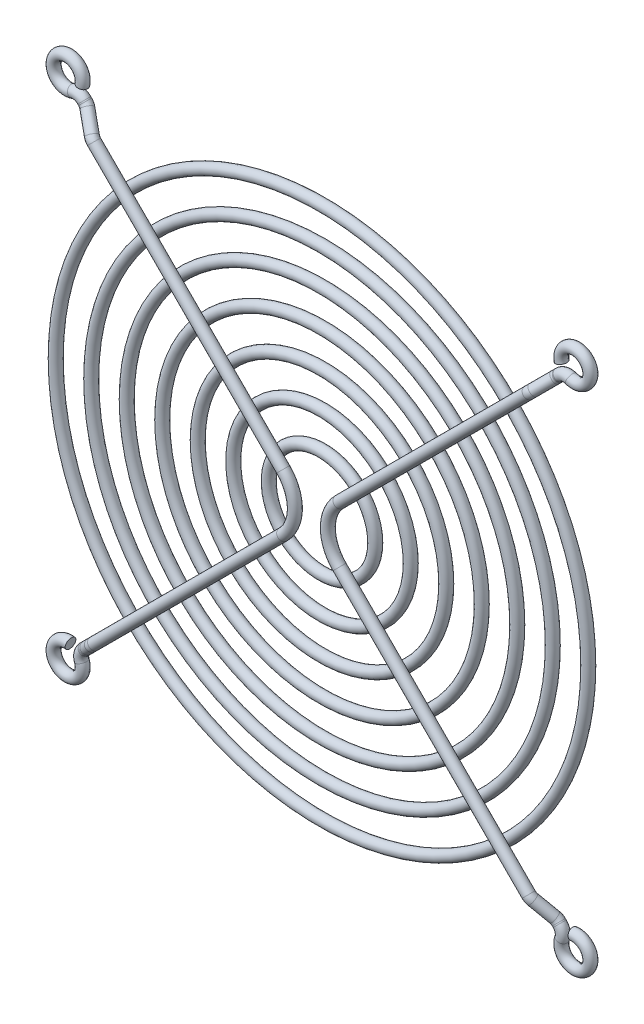
from build123d import *

# Parameters (mm, degrees)
SWEEP2_PROFILE_R     = 0.75
SWEEP3_PROFILE_R     = 0.75
SWEEP4_PROFILE_R     = 0.75
SWEEP5_PROFILE_R     = 0.75
SWEEP6_PROFILE_R     = 0.75
SWEEP7_PROFILE_R     = 0.75
SWEEP8_PROFILE_R     = 0.75
SWEEP10_OUTLINE_R    = 0.75
SWEEP10_ANGLE        = 299.351903
SWEEP10_2_OUTLINE_R  = 0.75
SWEEP10_2_ANGLE      = 65.00525
SWEEP10_3_OUTLINE_R  = 0.75
SWEEP10_3_ANGLE      = 24.91303
SWEEP10_4_OUTLINE_R  = 0.75
SWEEP10_4_ANGLE      = 24.91303
SWEEP10_5_OUTLINE_R  = 0.75
SWEEP10_5_ANGLE      = 90
SWEEP10_6_OUTLINE_R  = 0.75
SWEEP10_6_ANGLE      = 24.91303
SWEEP10_7_OUTLINE_R  = 0.75
SWEEP10_7_ANGLE      = 24.91303
SWEEP10_8_OUTLINE_R  = 0.75
SWEEP10_8_ANGLE      = 65.00525
SWEEP10_9_OUTLINE_R  = 0.75
SWEEP10_9_ANGLE      = 303.434631
SWEEP10_START        = -47.340604846
SWEEP10_10_OUTLINE_R = 0.75
SWEEP10_10_DEPTH     = 0.168652393
SWEEP10_START_2      = -42.150656374
SWEEP10_11_OUTLINE_R = 0.75
SWEEP10_11_DEPTH     = 2.898202414
SWEEP10_START_3      = -43.279707019
SWEEP10_12_OUTLINE_R = 0.75
SWEEP10_12_DEPTH     = 37.668652394
SWEEP10_13_OUTLINE_R = 0.75
SWEEP10_13_DEPTH     = 37.668652394
SWEEP10_14_OUTLINE_R = 0.75
SWEEP10_14_DEPTH     = 2.898202414
SWEEP10_15_OUTLINE_R = 0.75
SWEEP10_15_DEPTH     = 0.168652393


with BuildPart() as part:
    # Sweep2: sweep along a path in Sketch1
    with BuildLine(Plane.XY) as sweep2_path:
        CenterArc((0, 0), 7.5, 0, 360)
    # Sweep2 profile (on start of the path) → Sweep2 (sweep)
    with BuildSketch(Plane(origin=(7.5, 0, 0), x_dir=(0, 0, 1), z_dir=(0, 1, 0))):
        Circle(SWEEP2_PROFILE_R)
    sweep(path=sweep2_path.line)


with BuildPart() as body_2:
    # Sweep3: sweep along a path in Sketch38
    with BuildLine(Plane.XY) as sweep3_path:
        CenterArc((0, 0), 12.5, 0, 360)
    # Sweep3 profile (on start of the path) → Sweep3 (sweep)
    with BuildSketch(Plane(origin=(12.5, 0, 0), x_dir=(0, 0, 1), z_dir=(0, 1, 0))):
        Circle(SWEEP3_PROFILE_R)
    sweep(path=sweep3_path.line)


with BuildPart() as body_3:
    # Sweep4: sweep along a path in Sketch51
    with BuildLine(Plane.XY) as sweep4_path:
        CenterArc((0, 0), 17.5, 0, 360)
    # Sweep4 profile (on start of the path) → Sweep4 (sweep)
    with BuildSketch(Plane(origin=(17.5, 0, 0), x_dir=(0, 0, 1), z_dir=(0, 1, 0))):
        Circle(SWEEP4_PROFILE_R)
    sweep(path=sweep4_path.line)


with BuildPart() as body_4:
    # Sweep5: sweep along a path in Sketch76
    with BuildLine(Plane.XY) as sweep5_path:
        CenterArc((0, 0), 22.5, 0, 360)
    # Sweep5 profile (on start of the path) → Sweep5 (sweep)
    with BuildSketch(Plane(origin=(22.5, 0, 0), x_dir=(0, 0, 1), z_dir=(0, 1, 0))):
        Circle(SWEEP5_PROFILE_R)
    sweep(path=sweep5_path.line)


with BuildPart() as body_5:
    # Sweep6: sweep along a path in Sketch89
    with BuildLine(Plane.XY) as sweep6_path:
        CenterArc((0, 0), 27.5, 0, 360)
    # Sweep6 profile (on start of the path) → Sweep6 (sweep)
    with BuildSketch(Plane(origin=(27.5, 0, 0), x_dir=(0, 0, 1), z_dir=(0, 1, 0))):
        Circle(SWEEP6_PROFILE_R)
    sweep(path=sweep6_path.line)


with BuildPart() as body_6:
    # Sweep7: sweep along a path in Sketch99
    with BuildLine(Plane.XY) as sweep7_path:
        CenterArc((0, 0), 32.5, 0, 360)
    # Sweep7 profile (on start of the path) → Sweep7 (sweep)
    with BuildSketch(Plane(origin=(32.5, 0, 0), x_dir=(0, 0, 1), z_dir=(0, 1, 0))):
        Circle(SWEEP7_PROFILE_R)
    sweep(path=sweep7_path.line)


with BuildPart() as body_7:
    # Sweep8: sweep along a path in Sketch108
    with BuildLine(Plane.XY) as sweep8_path:
        CenterArc((0, 0), 37.5, 0, 360)
    # Sweep8 profile (on start of the path) → Sweep8 (sweep)
    with BuildSketch(Plane(origin=(37.5, 0, 0), x_dir=(0, 0, 1), z_dir=(0, 1, 0))):
        Circle(SWEEP8_PROFILE_R)
    sweep(path=sweep8_path.line)


with BuildPart() as body_8:
    # Sweep10: read off the stored shape, not the designer's step
    # Sweep10 outline → Sweep10 (revolve)
    with BuildSketch(Plane(origin=(-35.75, -35.75, 0), x_dir=(0.1624073083987901, 0.9867238044045863, 0), z_dir=(0.9867238044045863, -0.1624073083987901, 0))):
        with Locations((2.05, 0)):
            Circle(SWEEP10_OUTLINE_R)
    revolve(axis=Axis((-35.75, -35.75, 0), (0, 0, 1)), revolution_arc=SWEEP10_ANGLE)

    # Sweep10 2 outline → Sweep10 2 (revolve)
    with BuildSketch(Plane(origin=(-32.41420247, -34.535522813, 0), x_dir=(-0.7071067811867158, 0.7071067811863793, 0), z_dir=(0.7071067811863793, 0.7071067811867158, 0))):
        with Locations((1.5, 0)):
            Circle(SWEEP10_2_OUTLINE_R)
    revolve(axis=Axis((-32.41420247, -34.535522813, 0), (0, 0, 1)), revolution_arc=SWEEP10_2_ANGLE)

    # Sweep10 3 outline → Sweep10 3 (revolve)
    with BuildSketch(Plane(origin=(-33.355607532, -33.355607532, 1.5), x_dir=(0, 0, -1), z_dir=(-0.707106781186402, -0.707106781186693, -2.2816783892076807e-15))):
        with Locations((1.5, 0)):
            Circle(SWEEP10_3_OUTLINE_R)
    revolve(axis=Axis((-33.355607532, -33.355607532, 1.5), (0.707106781186693, -0.707106781186402, 0)), revolution_arc=SWEEP10_3_ANGLE)

    # Sweep10 4 outline → Sweep10 4 (revolve)
    with BuildSketch(Plane(origin=(-30.60337425, -30.60337425, 0), x_dir=(0, 0, 1), z_dir=(0.70710678118655, 0.707106781186545, -3.8359906236829e-15))):
        with Locations((1.5, 0)):
            Circle(SWEEP10_4_OUTLINE_R)
    revolve(axis=Axis((-30.60337425, -30.60337425, 0), (0.707106781186545, -0.70710678118655, 0)), revolution_arc=SWEEP10_4_ANGLE)

    # Sweep10 5 outline → Sweep10 5 (revolve)
    with BuildSketch(Plane(origin=(-7.935229692, 0, 0), x_dir=(0.7071067811865476, -0.7071067811865475, 0), z_dir=(-0.7071067811865475, -0.7071067811865476, 0))):
        with Locations((5.611054725, 1.5)):
            Circle(SWEEP10_5_OUTLINE_R)
    revolve(axis=Axis((-7.935229692, 0, 0), (0, 0, 1)), revolution_arc=SWEEP10_5_ANGLE)

    # Sweep10 6 outline → Sweep10 6 (revolve)
    with BuildSketch(Plane(origin=(-30.60337425, 30.60337425, 0), x_dir=(-0.2978631298041014, 0.2978631298041026, 0.9069482409744282), z_dir=(-0.6413092513782278, 0.6413092513782305, -0.4212420778998587))):
        with Locations((1.5, 0)):
            Circle(SWEEP10_6_OUTLINE_R)
    revolve(axis=Axis((-30.60337425, 30.60337425, 0), (0.707106781186549, 0.7071067811865461, 0)), revolution_arc=SWEEP10_6_ANGLE)

    # Sweep10 7 outline → Sweep10 7 (revolve)
    with BuildSketch(Plane(origin=(-33.355607532, 33.355607532, 1.5), x_dir=(0.2978631298041064, -0.29786312980410656, -0.9069482409744252), z_dir=(0.641309251378227, -0.641309251378227, 0.42124207789986506))):
        with Locations((1.5, 0)):
            Circle(SWEEP10_7_OUTLINE_R)
    revolve(axis=Axis((-33.355607532, 33.355607532, 1.5), (0.7071067811865476, 0.7071067811865475, 0)), revolution_arc=SWEEP10_7_ANGLE)

    # Sweep10 8 outline → Sweep10 8 (revolve)
    with BuildSketch(Plane(origin=(-34.535522813, 32.41420247, 0), x_dir=(0.7071067811865493, 0.7071067811865457, 0), z_dir=(0.7071067811865457, -0.7071067811865493, 0))):
        with Locations((1.5, 0)):
            Circle(SWEEP10_8_OUTLINE_R)
    revolve(axis=Axis((-34.535522813, 32.41420247, 0), (0, 0, 1)), revolution_arc=SWEEP10_8_ANGLE)

    # Sweep10 9 outline → Sweep10 9 (revolve)
    with BuildSketch(Plane(origin=(-35.75, 35.75, 0), x_dir=(0.9726569125265558, -0.23224670183730892, 0), z_dir=(-0.23224670183730892, -0.9726569125265558, 0))):
        with Locations((2.05, 0)):
            Circle(SWEEP10_9_OUTLINE_R)
    revolve(axis=Axis((-35.75, 35.75, 0), (0, 0, 1)), revolution_arc=SWEEP10_9_ANGLE)

    # Sweep10 10 outline → Sweep10 10 (add)
    with BuildSketch(Plane(origin=(0, 0, 0), x_dir=(0.7071067811866915, -0.7071067811864037, 0), z_dir=(0.7071067811864036, 0.7071067811866916, 0)).offset(SWEEP10_START)):
        Circle(SWEEP10_10_OUTLINE_R)
    extrude(amount=SWEEP10_10_DEPTH)

    # Sweep10 11 outline → Sweep10 11 (add)
    with BuildSketch(Plane(origin=(0, 0, 0), x_dir=(0.7672825060541113, -0.5360184191066626, -0.35208210730128936), z_dir=(0.641309251378243, 0.641309251378244, 0.421242077899815)).offset(SWEEP10_START_2)):
        with Locations((-7.659769342, -18.183770673)):
            Circle(SWEEP10_11_OUTLINE_R)
    extrude(amount=SWEEP10_11_DEPTH)

    # Sweep10 12 outline → Sweep10 12 (add)
    with BuildSketch(Plane(origin=(0, 0, 0), x_dir=(0.7071067811865471, -0.707106781186548, 0), z_dir=(0.707106781186548, 0.707106781186547, 0)).offset(SWEEP10_START_3)):
        with Locations((0, -1.5)):
            Circle(SWEEP10_12_OUTLINE_R)
    extrude(amount=SWEEP10_12_DEPTH)

    # Sweep10 13 outline → Sweep10 13 (add)
    with BuildSketch(Plane(origin=(0, 0, 0), x_dir=(0.7071067811865474, 0.7071067811865477, 0), z_dir=(0.7071067811865476, -0.7071067811865476, 0)).offset(SWEEP10_START_3)):
        with Locations((0, 1.5)):
            Circle(SWEEP10_13_OUTLINE_R)
    extrude(amount=SWEEP10_13_DEPTH)

    # Sweep10 14 outline → Sweep10 14 (add)
    with BuildSketch(Plane(origin=(0, 0, 0), x_dir=(0.767282506054122, 0.5360184191066334, -0.3520821073013112), z_dir=(0.6413092513782304, -0.6413092513782304, 0.4212420778998552)).offset(SWEEP10_START_2)):
        with Locations((-7.659769342, 18.183770673)):
            Circle(SWEEP10_14_OUTLINE_R)
    extrude(amount=SWEEP10_14_DEPTH)

    # Sweep10 15 outline → Sweep10 15 (add)
    with BuildSketch(Plane(origin=(0, 0, 0), x_dir=(0.7071067811865474, 0.7071067811865477, 0), z_dir=(0.7071067811865476, -0.7071067811865476, 0)).offset(SWEEP10_START)):
        Circle(SWEEP10_15_OUTLINE_R)
    extrude(amount=SWEEP10_15_DEPTH)


with BuildPart() as body_9:
    # Mirror1: mirrored copy
    add(body_8.part.mirror(Plane(origin=(0, 0, 0), x_dir=(0, 0, 1), z_dir=(1, 0, 0))))


solid = Compound([part.part, body_2.part, body_3.part, body_4.part, body_5.part, body_6.part, body_7.part, body_8.part, body_9.part])
